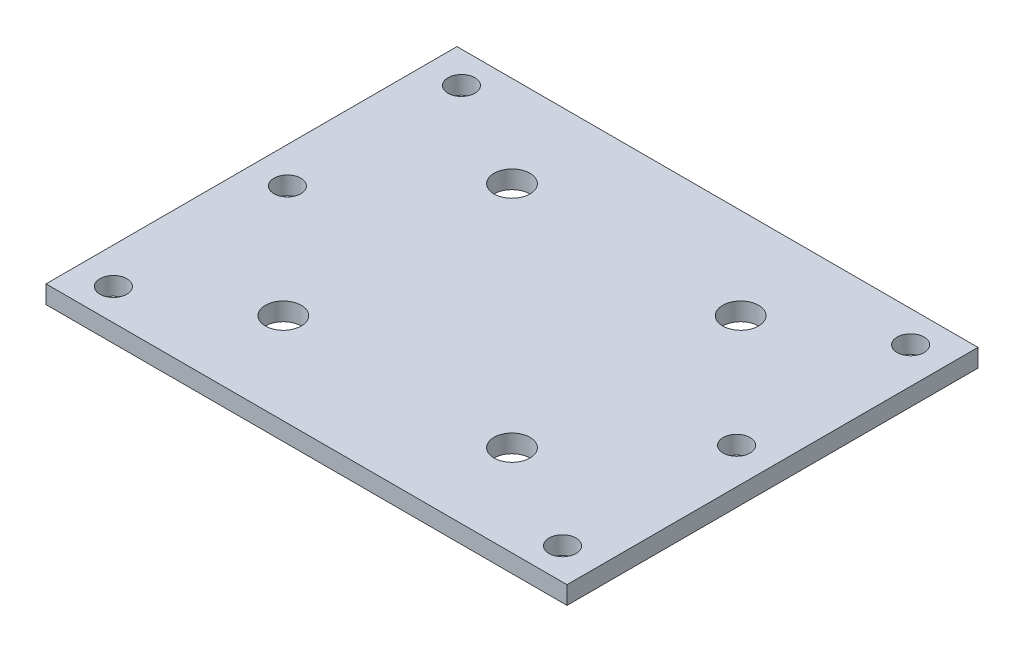
from build123d import *

# Parameters (mm, degrees)
BASE_PLATE_W         = 58
BASE_PLATE_H         = 45.75
BOSS_EXTRUDE1_DEPTH  = 2
MOTOR_HOLES_M4_D     = 4
CLAMP_HOLES_M3_D     = 3
CLAMP_HOLES_M3_DEPTH = 100
CLAMP_HOLES_M3_TIP   = 0.901290929


with BuildPart() as part:
    # Base Plate → Boss-Extrude1 (new body)
    with BuildSketch(Plane(origin=(0, 0, 0), x_dir=(1, 0, 0), z_dir=(0, 1, 0))):
        Rectangle(BASE_PLATE_W, BASE_PLATE_H)
    extrude(amount=BOSS_EXTRUDE1_DEPTH)

    # Motor Holes M4 (through all)
    with Locations(Plane(origin=(0, 2, 0), x_dir=(1, 0, 0), z_dir=(0, 1, 0))):
        with Locations((-12.727922061, -12.727922061), (-12.727922061, 12.727922061), (12.727922061, 12.727922061), (12.727922061, -12.727922061)):
            Hole(MOTOR_HOLES_M4_D / 2)

    # Clamp Holes M3
    with Locations(Plane(origin=(0, 0, 0), x_dir=(-1, 0, 0), z_dir=(0, -1, 0))):
        with Locations((25, 19.375), (-25, -19.375), (-25, 19.375), (25, -19.375), (-25, 0), (25, 0)):
            Hole(CLAMP_HOLES_M3_D / 2, depth=CLAMP_HOLES_M3_DEPTH)
            with Locations((0, 0, -(CLAMP_HOLES_M3_DEPTH + CLAMP_HOLES_M3_TIP / 2))):  # 118° drill point
                Cone(0, CLAMP_HOLES_M3_D / 2, CLAMP_HOLES_M3_TIP, mode=Mode.SUBTRACT)


solid = part.part
